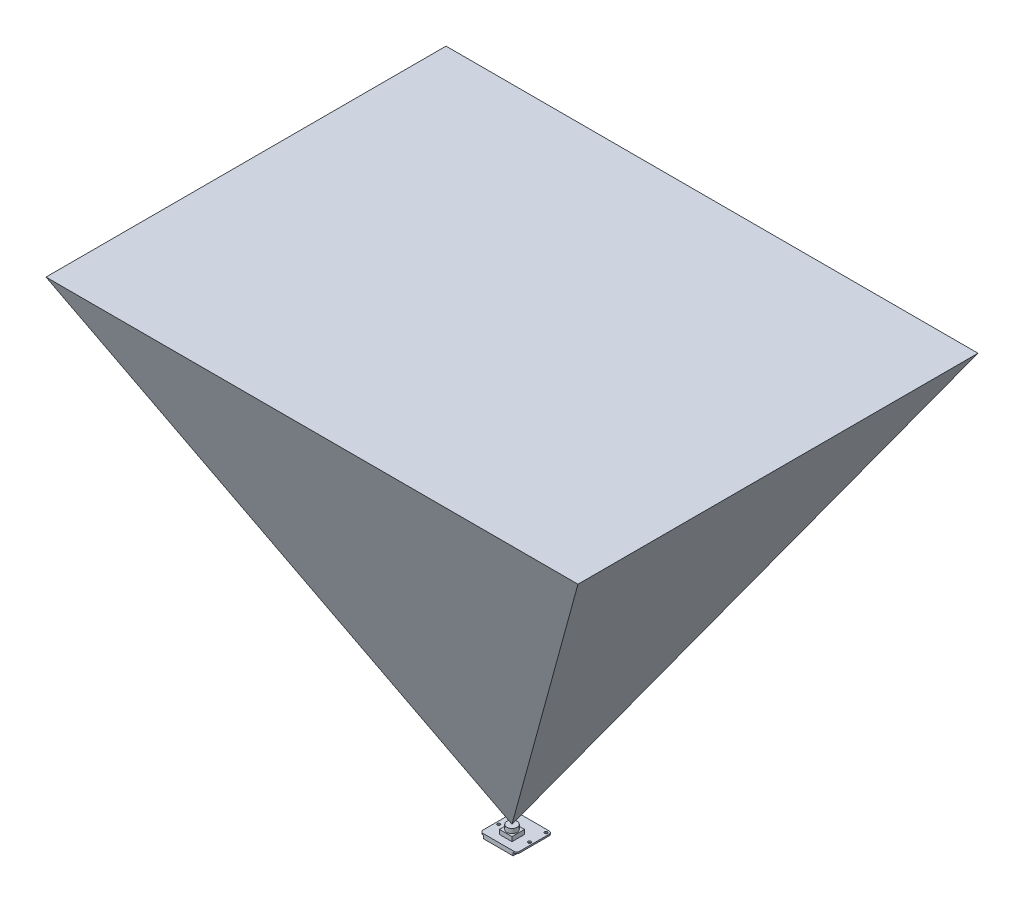
from build123d import *

# Parameters (mm, degrees)
SKETCH1_W           = 25
SKETCH1_H           = 24
BOSS_EXTRUDE1_DEPTH = 1
SKETCH2_W           = 8.5
SKETCH2_H           = 8.5
BOSS_EXTRUDE2_DEPTH = 3
SKETCH3_R           = 3.5
BOSS_EXTRUDE3_DEPTH = 3
SKETCH4_W           = 20
SKETCH4_H           = 5.4
BOSS_EXTRUDE4_DEPTH = 2
SKETCH5_R           = 1
CUT_EXTRUDE1_DEPTH  = 36.17101079
FILLET1_R           = 2
BOSS_EXTRUDE5_DEPTH = 200
BOSS_EXTRUDE6_DEPTH = 200


with BuildPart() as part:
    # Sketch1 → Boss-Extrude1 (new body)
    with BuildSketch(Plane(origin=(0, 0, 0), x_dir=(1, 0, 0), z_dir=(0, 1, 0))):
        with Locations((12.5, 12)):
            Rectangle(SKETCH1_W, SKETCH1_H)
    extrude(amount=BOSS_EXTRUDE1_DEPTH)

    # Sketch2 → Boss-Extrude2 (add)
    with BuildSketch(Plane(origin=(0, 1, 0), x_dir=(1, 0, 0), z_dir=(0, 1, 0))):
        with Locations((12.5, 9.25)):
            Rectangle(SKETCH2_W, SKETCH2_H)
    extrude(amount=BOSS_EXTRUDE2_DEPTH)

    # Sketch3 → Boss-Extrude3 (add)
    with BuildSketch(Plane(origin=(0, 4, 0), x_dir=(1, 0, 0), z_dir=(0, 1, 0))):
        with Locations(Location((12.5, 9.25, 0), (0, 0, 90))):
            Circle(SKETCH3_R)
    extrude(amount=BOSS_EXTRUDE3_DEPTH)

    # Sketch4 → Boss-Extrude4 (add)
    with BuildSketch(Plane.XZ):
        with Locations((12.5, -2.7)):
            Rectangle(SKETCH4_W, SKETCH4_H)
    extrude(amount=BOSS_EXTRUDE4_DEPTH)

    # Sketch5 → Cut-Extrude1 (cut, through all)
    with BuildSketch(Plane(origin=(0, 1, 0), x_dir=(1, 0, 0), z_dir=(0, 1, 0))):
        with Locations(Location((2, 10.7, 0), (0, 0, 270))):
            Circle(SKETCH5_R)
        with Locations(Location((2, 22, 0), (0, 0, 270))):
            Circle(SKETCH5_R)
        with Locations(Location((23, 22, 0), (0, 0, 270))):
            Circle(SKETCH5_R)
        with Locations(Location((23, 10.7, 0), (0, 0, 270))):
            Circle(SKETCH5_R)
    extrude(amount=-CUT_EXTRUDE1_DEPTH, mode=Mode.SUBTRACT)

    # Fillet1
    fillet1_edges = [part.edges().sort_by_distance(p)[0] for p in [
        (0, 0.5, -24),
        (25, 0.5, -24),
        (25, 0.5, 0),
        (0, 0.5, 0),
    ]]
    fillet(fillet1_edges, radius=FILLET1_R)


with BuildPart() as body_2:
    # Sketch6 → Boss-Extrude5 (new, symmetric)
    with BuildSketch(Plane(origin=(0, 0, 0), x_dir=(0, 0, -1), z_dir=(1, 0, 0))):
        Polygon((9.25, 7), (-126.836035449, 307), (145.336035449, 307), align=None)
    extrude(amount=BOSS_EXTRUDE5_DEPTH, both=True)


with BuildPart() as body_3:
    # Sketch8 → Boss-Extrude6 (new, symmetric)
    with BuildSketch(Plane.XY):
        Polygon((12.5, 7), (-168.471570024, 307), (193.471570024, 307), align=None)
    extrude(amount=BOSS_EXTRUDE6_DEPTH, both=True)

    # Intersect1: read off the stored shape, not the designer's step
    # Intersect1: intersect body 2
    add(body_2.part, mode=Mode.INTERSECT)


solid = Compound([part.part, body_3.part])
